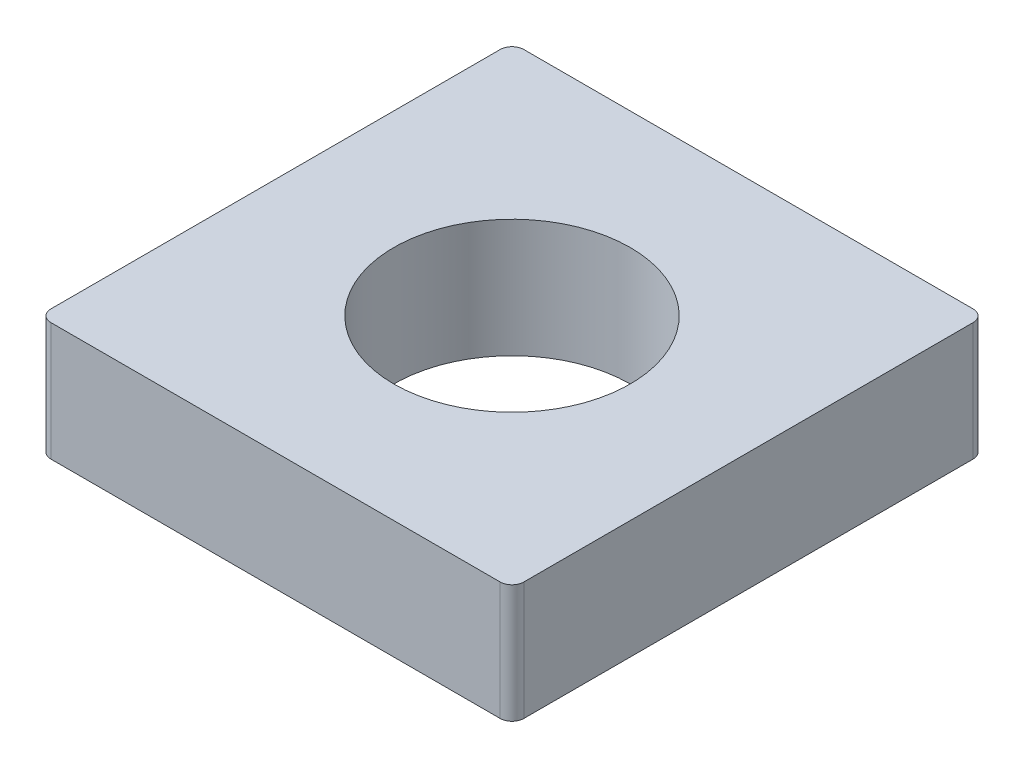
from build123d import *

# Parameters (mm, degrees)
SKETCH_1_W      = 8
SKETCH_1_H      = 8
SKETCH_1_R      = 2
EXTRUDE_1_DEPTH = 1
FILLET_1_R      = 0.2


with BuildPart() as part:
    # 草图1 → 凸台-拉伸1 (new, symmetric)
    with BuildSketch(Plane(origin=(0, 0, 0), x_dir=(1, 0, 0), z_dir=(0, 1, 0))):
        Rectangle(SKETCH_1_W, SKETCH_1_H)
        Circle(SKETCH_1_R, mode=Mode.SUBTRACT)
    extrude(amount=EXTRUDE_1_DEPTH, both=True)

    # 圆角1
    fillet_1_edges = [part.edges().sort_by_distance(p)[0] for p in [
        (-4, 0, -4),
        (4, 0, -4),
        (4, 0, 4),
        (-4, 0, 4),
    ]]
    fillet(fillet_1_edges, radius=FILLET_1_R)


solid = part.part
